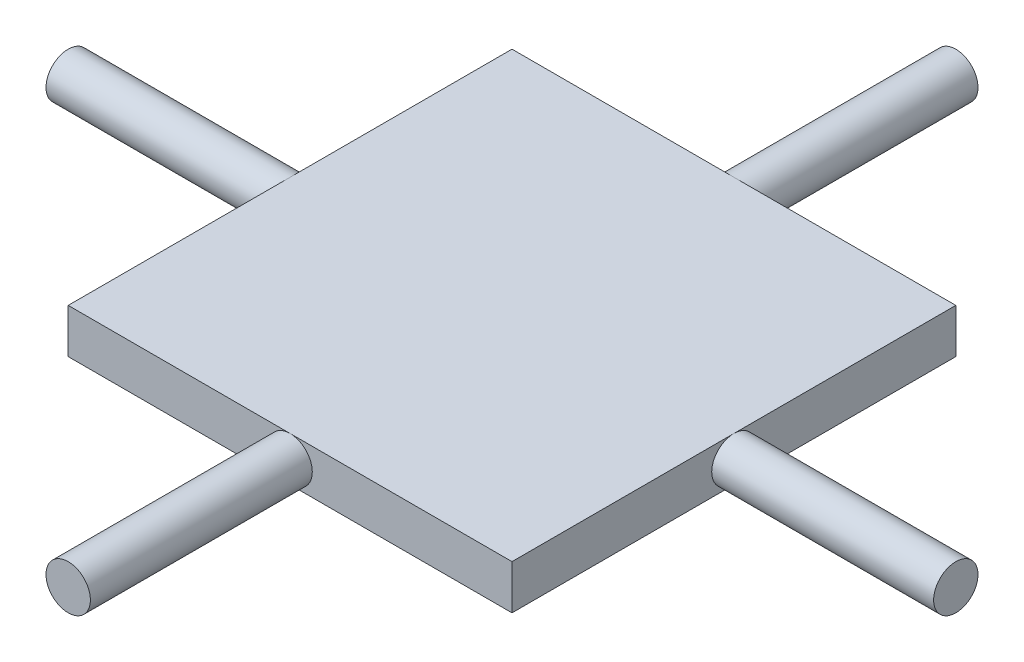
from build123d import *

# Parameters (mm, degrees)
SKETCH2_W           = 100
SKETCH2_H           = 100
BOSS_EXTRUDE1_DEPTH = 5
SKETCH3_W           = 100
SKETCH3_H           = 100
BOSS_EXTRUDE2_DEPTH = 5
SKETCH4_R           = 5
BOSS_EXTRUDE3_DEPTH = 50
SKETCH5_R           = 5
BOSS_EXTRUDE4_DEPTH = 50
BOSS_EXTRUDE5_START = 50
SKETCH6_R           = 5
BOSS_EXTRUDE5_DEPTH = 50
BOSS_EXTRUDE6_START = 50
SKETCH7_R           = 5
BOSS_EXTRUDE6_DEPTH = 50


with BuildPart() as part:
    # Sketch2 → Boss-Extrude1 (new body)
    with BuildSketch(Plane(origin=(0, 0, 0), x_dir=(1, 0, 0), z_dir=(0, 1, 0))):
        Rectangle(SKETCH2_W, SKETCH2_H)
    extrude(amount=BOSS_EXTRUDE1_DEPTH)

    # Sketch3 → Boss-Extrude2 (add)
    with BuildSketch(Plane.XZ):
        Rectangle(SKETCH3_W, SKETCH3_H)
    extrude(amount=BOSS_EXTRUDE2_DEPTH)

    # Sketch4 → Boss-Extrude3 (add)
    with BuildSketch(Plane.XY.offset(50)):
        Circle(SKETCH4_R)
    extrude(amount=BOSS_EXTRUDE3_DEPTH)

    # Sketch5 → Boss-Extrude4 (add)
    with BuildSketch(Plane.ZY.offset(50)):
        Circle(SKETCH5_R)
    extrude(amount=BOSS_EXTRUDE4_DEPTH)

    # Sketch6 → Boss-Extrude5 (add)
    with BuildSketch(Plane(origin=(0, 0, -50), x_dir=(-1, 0, 0), z_dir=(0, 0, -1)).offset(BOSS_EXTRUDE5_START)):
        Circle(SKETCH6_R)
    extrude(amount=-BOSS_EXTRUDE5_DEPTH)

    # Sketch7 → Boss-Extrude6 (add)
    with BuildSketch(Plane(origin=(50, 0, 0), x_dir=(0, 0, -1), z_dir=(1, 0, 0)).offset(BOSS_EXTRUDE6_START)):
        Circle(SKETCH7_R)
    extrude(amount=-BOSS_EXTRUDE6_DEPTH)


solid = part.part
